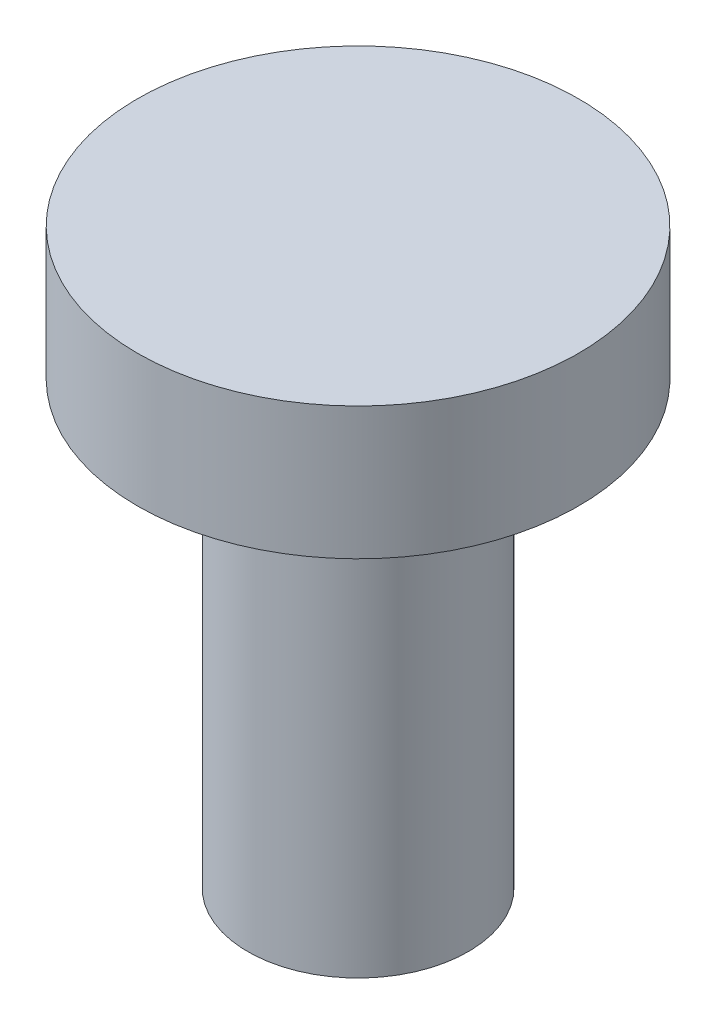
from build123d import *

# Parameters (mm, degrees)
SKETCH1_R           = 5
BOSS_EXTRUDE1_DEPTH = 3
SKETCH2_R           = 2.5
BOSS_EXTRUDE2_DEPTH = 10


with BuildPart() as part:
    # Sketch1 → Boss-Extrude1 (new body)
    with BuildSketch(Plane(origin=(0, 0, 0), x_dir=(1, 0, 0), z_dir=(0, 1, 0))):
        Circle(SKETCH1_R)
    extrude(amount=BOSS_EXTRUDE1_DEPTH)

    # Sketch2 → Boss-Extrude2 (add)
    with BuildSketch(Plane.XZ):
        Circle(SKETCH2_R)
    extrude(amount=BOSS_EXTRUDE2_DEPTH)


solid = part.part
